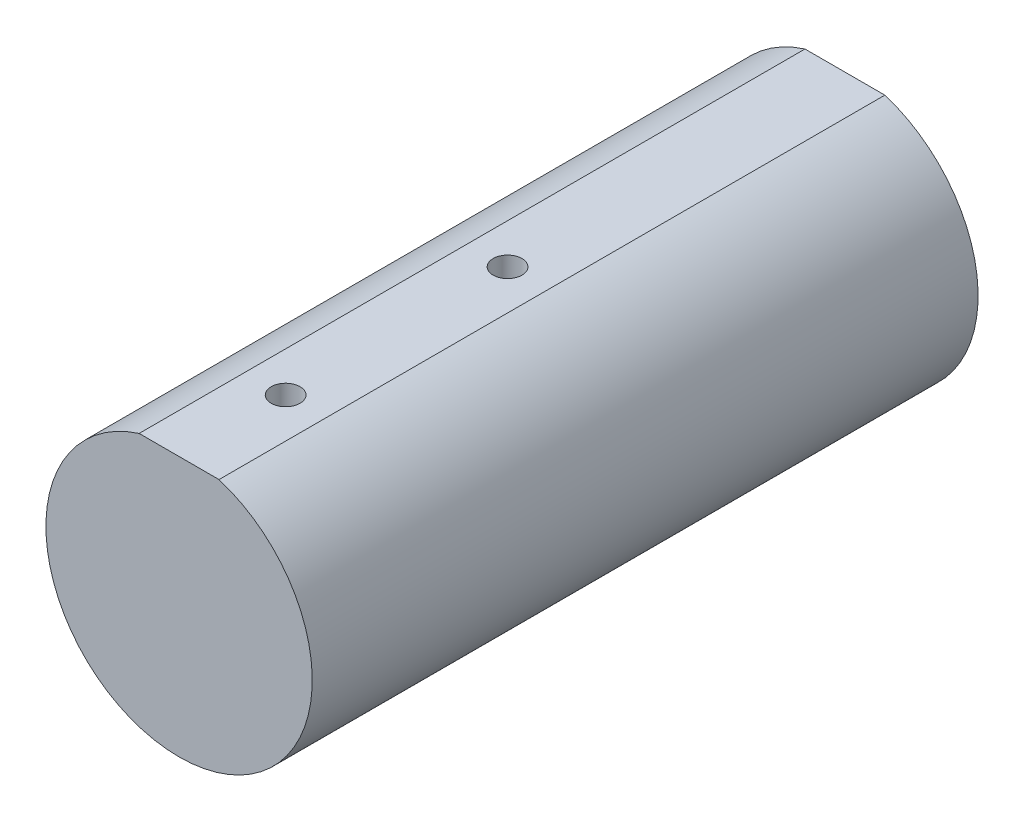
from build123d import *

# Parameters (mm, degrees)
SKETCH1_R           = 15
BOSS_EXTRUDE1_DEPTH = 37.5
SKETCH2_W           = 9
SKETCH2_H           = 5
CUT_EXTRUDE1_DEPTH  = 78.942286341
SKETCH3_R           = 1.625
CUT_EXTRUDE2_DEPTH  = 50.9026316
CUT_EXTRUDE3_START  = -20
SKETCH4_R           = 4
CUT_EXTRUDE3_DEPTH  = 150


with BuildPart() as part:
    # Sketch1 → Boss-Extrude1 (new, symmetric)
    with BuildSketch(Plane.XY):
        Circle(SKETCH1_R)
    extrude(amount=BOSS_EXTRUDE1_DEPTH, both=True)

    # Sketch2 → Cut-Extrude1 (cut, through all)
    with BuildSketch(Plane.XY.offset(37.5)):
        with Locations((0, 16.809088021)):
            Rectangle(SKETCH2_W, SKETCH2_H)
    extrude(amount=-CUT_EXTRUDE1_DEPTH, mode=Mode.SUBTRACT)

    # Sketch3 → Cut-Extrude2 (cut, through all)
    with BuildSketch(Plane(origin=(0, 14.309088021, 0), x_dir=(1, 0, 0), z_dir=(0, 1, 0))):
        with Locations((0, -25.5)):
            Circle(SKETCH3_R)
        with Locations((0, -0.5)):
            Circle(SKETCH3_R)
    extrude(amount=-CUT_EXTRUDE2_DEPTH, mode=Mode.SUBTRACT)

    # Sketch4 → Cut-Extrude3 (cut)
    with BuildSketch(Plane(origin=(0, 14.309088021, 0), x_dir=(1, 0, 0), z_dir=(0, 1, 0)).offset(CUT_EXTRUDE3_START)):
        with Locations((0, -0.5)):
            Circle(SKETCH4_R)
        with Locations((0, -25.5)):
            Circle(SKETCH4_R)
    extrude(amount=-CUT_EXTRUDE3_DEPTH, mode=Mode.SUBTRACT)


solid = part.part
